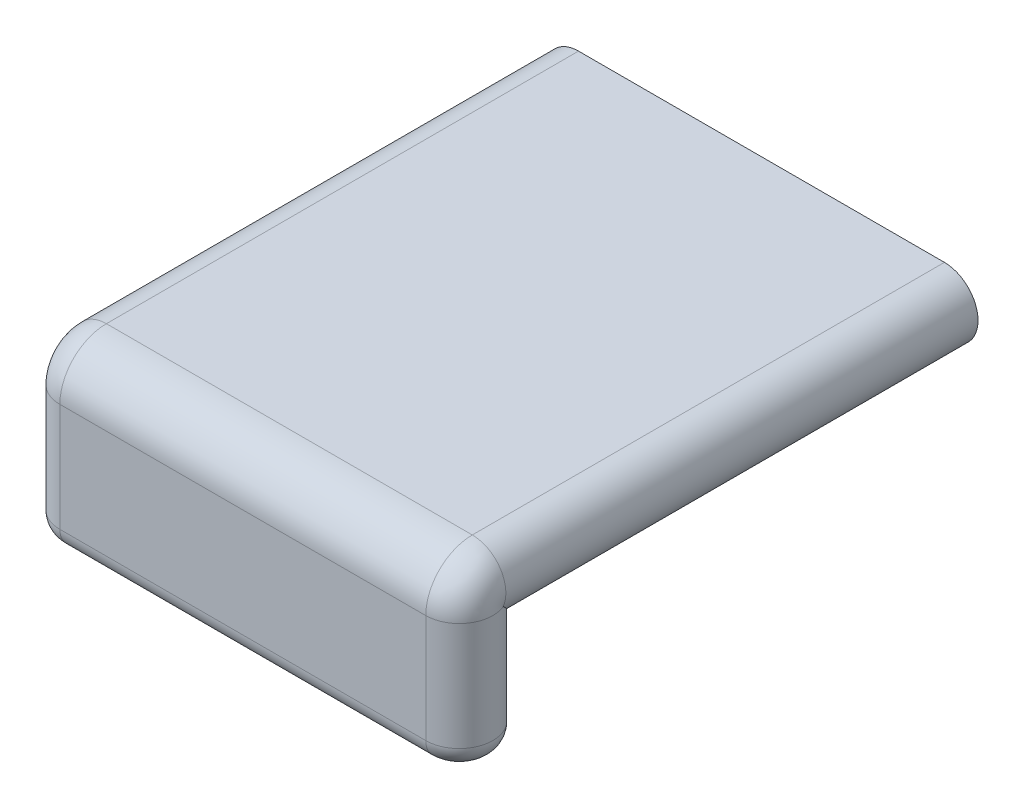
from build123d import *

# Parameters (mm, degrees)
BOSS_EXTRUDE1_DEPTH = 10.9032
SKETCH2_W           = 9
SKETCH2_H           = 0.5
CUT_EXTRUDE1_DEPTH  = 13.01999980199667
FILLET1_R           = 0.2
SWEEP1_START        = -3.3
SWEEP1_DEPTH        = 3.05
SWEEP1_2_ANGLE      = 90
FILLET2_R           = 0.5


with BuildPart() as part:
    # Sketch1 → Boss-Extrude1 (new body)
    with BuildSketch(Plane.XY):
        with BuildLine():
            Line((-4.225, 0.7750000000000001), (4.225, 0.7750000000000001))
            ThreePointArc((4.225, 0.7750000000000001), (5, 0), (4.225, -0.7750000000000001))
            Line((4.225, -0.7750000000000001), (-4.225, -0.7750000000000001))
            ThreePointArc((-4.225, -0.7750000000000001), (-5, 9e-17), (-4.225, 0.7750000000000001))
        make_face()
    extrude(amount=BOSS_EXTRUDE1_DEPTH)

    # Sketch2 → Cut-Extrude1 (cut, through all)
    with BuildSketch(Plane.XY.offset(10.9032)):
        Rectangle(SKETCH2_W, SKETCH2_H)
    extrude(amount=-CUT_EXTRUDE1_DEPTH, mode=Mode.SUBTRACT)

    # Fillet1
    fillet1_edges = [part.edges().sort_by_distance(p)[0] for p in [
        (4.500000000000003, 0.2500000000000001, 5.4516),
        (4.500000000000003, -0.2499999999999999, 5.4516),
        (-4.499999999999997, -0.2499999999999999, 5.4516),
        (-4.499999999999997, 0.2500000000000001, 5.4516),
    ]]
    fillet(fillet1_edges, radius=FILLET1_R)

    # Sweep1: read off the stored shape, not the designer's step
    # Sweep1 outline → Sweep1 (add)
    with BuildSketch(Plane(origin=(0, 0, 0), x_dir=(1, 0, 0), z_dir=(0, 1, 0)).offset(SWEEP1_START)):
        with BuildLine():
            Line((-4.225, -11.9782), (4.225, -11.9782))
            ThreePointArc((4.225, -11.9782), (5, -11.2032), (4.225, -10.4282))
            Line((4.225, -10.4282), (-4.225, -10.4282))
            ThreePointArc((-4.225, -10.4282), (-5, -11.2032), (-4.225, -11.9782))
        make_face()
    extrude(amount=SWEEP1_DEPTH)

    # Sweep1 2 outline → Sweep1 2 (revolve)
    with BuildSketch(Plane(origin=(0, -0.3, 10.9032), x_dir=(0, 1, -1.44e-15), z_dir=(0, -1.44e-15, -1))):
        with BuildLine():
            Line((0, 4.939580296), (0, -4.939580296))
            add(Edge.make_bspline(
                [(0, -4.939580296), (0.0519570394689895, -4.961393256983593), (0.10841554643003581, -4.979542137191699), (0.1692061790231751, -4.992872607462927), (0.23352242585972577, -5.000000001245932), (0.538087621369197, -4.999999995537749), (0.8228689184127496, -4.905109045106682), (1.0076156687544926, -4.675143876063141), (1.075000000000001, -4.4268164646885895), (1.075, -4.225)],
                knots=[1.5386603530075902, 1.5386603530075902, 1.5386603530075902, 1.5386603530075902, 1.5386603530075902, 1.5386603530075902, 1.968277128944731, 1.968277128944731, 1.968277128944731, 1.968277128944731, 3.5069374819523116, 3.5069374819523116, 3.5069374819523116, 3.5069374819523116, 3.5069374819523116, 3.5069374819523116], degree=5, weights=[1, 0.9999999999999993, 1.0001144222703127, 1.000064472262904, 1.0000000000000007, 1.0000000000000002, 0.9635119774531175, 0.9749056251717576, 1.000000000000001, 1]))
            Line((1.075, -4.225), (1.075, 4.225))
            add(Edge.make_bspline(
                [(1.075, 4.225), (1.0750000000000006, 4.426816468221435), (1.0076156662304492, 4.6751438856768095), (0.8228689080824526, 4.905109057133026), (0.5380876027644639, 5.000000001939648), (0.23352240972853552, 4.999999999458421), (0.16920616758934218, 4.992872604955472), (0.10841553935261468, 4.97954213491664), (0.05195703621157381, 4.961393255616055), (0, 4.939580296)],
                knots=[4.744524927237428, 4.744524927237428, 4.744524927237428, 4.744524927237428, 4.744524927237428, 4.744524927237428, 6.283185307179587, 6.283185307179587, 6.283185307179587, 6.283185307179587, 6.712802056182165, 6.712802056182165, 6.712802056182165, 6.712802056182165, 6.712802056182165, 6.712802056182165], degree=5, weights=[1, 0.9999999999999987, 0.9749056227861467, 0.9635119748925262, 1.0000000000000018, 1.0000000000000044, 1.0000644722550744, 1.0001144222464367, 0.999999999999996, 1]))
        make_face()
    revolve(axis=Axis((0, -0.3, 10.9032), (1, 0, 0)), revolution_arc=SWEEP1_2_ANGLE)

    # Fillet2
    fillet2_edges = [part.edges().sort_by_distance(p)[0] for p in [
        (-4.999999999999999, -3.3, 11.203199999999999),
        (0, -3.3, 10.4282),
        (4.999999999999999, -3.3, 11.203199999999999),
        (0, -3.3, 11.9782),
    ]]
    fillet(fillet2_edges, radius=FILLET2_R)


solid = part.part
